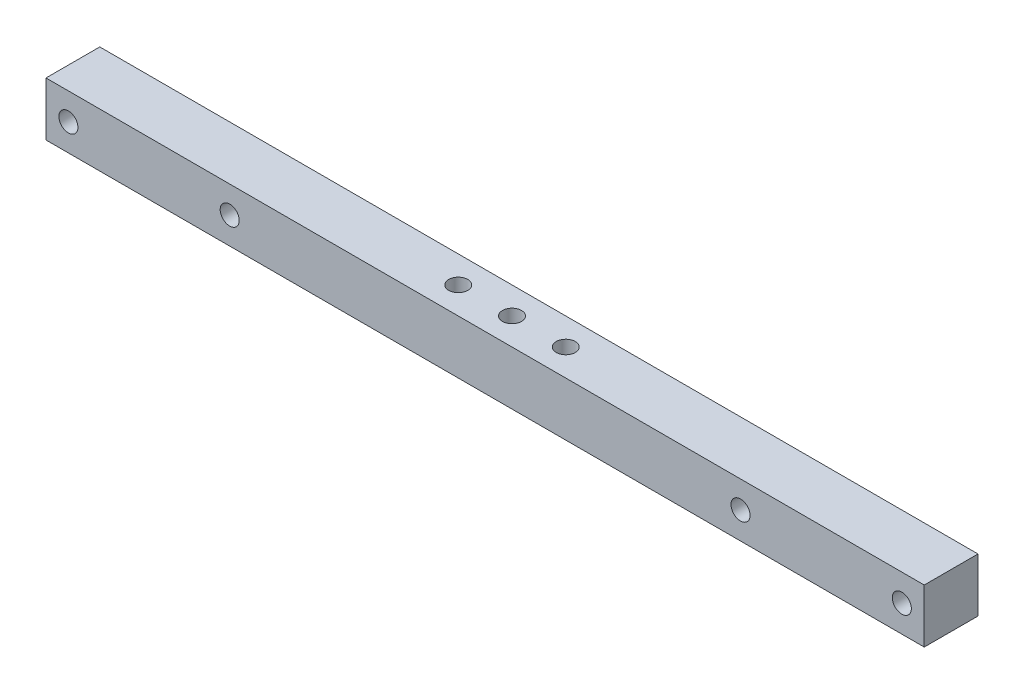
from build123d import *

# Parameters (mm, degrees)
SKETCH1_W               = 311.15
SKETCH1_H               = 19.05
BOSS_EXTRUDE1_DEPTH     = 19.05
F_1_4_CLEARANCE_HOLE1_D = 6.7564
F_1_4_CLEARANCE_HOLE2_D = 6.7564


with BuildPart() as part:
    # Sketch1 → Boss-Extrude1 (new body)
    with BuildSketch(Plane.XY):
        Rectangle(SKETCH1_W, SKETCH1_H)
    extrude(amount=BOSS_EXTRUDE1_DEPTH)

    # 1/4 Clearance Hole1 (through all)
    with Locations(Plane.XY.offset(19.05)):
        with Locations((-147.6375, 0), (-90.4875, 0)):
            f_1_4_clearance_hole1 = Hole(F_1_4_CLEARANCE_HOLE1_D / 2)

    # Mirror1: 1/4 Clearance Hole1 across plane
    add(f_1_4_clearance_hole1.mirror(Plane(origin=(0, 0, 0), x_dir=(0, 0, 1), z_dir=(1, 0, 0))), mode=Mode.SUBTRACT)

    # 1/4 Clearance Hole2 (through all)
    with Locations(Plane(origin=(0, 9.525, 0), x_dir=(1, 0, 0), z_dir=(0, 1, 0))):
        with Locations((-19.05, -9.525), (0, -9.525), (19.05, -9.525)):
            Hole(F_1_4_CLEARANCE_HOLE2_D / 2)


solid = part.part
